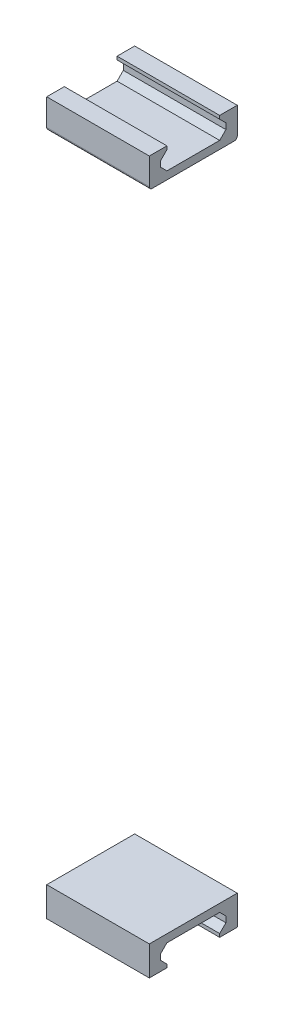
from build123d import *

# Parameters (mm, degrees)
BOSS_EXTRUDE1_DEPTH = 35
FILLET1_R           = 1


with BuildPart() as part:
    # Sketch1 → Boss-Extrude1 (new body)
    with BuildSketch(Plane.YZ):
        Polygon((60.116092999, 26.392150669), (61.250815122, 26.392150669), (61.250815122, 32.392150669), (51.18048308, 32.392150669), (51.18048308, 2.389198142), (61.250815122, 2.389198142), (61.250815122, 8.389198142), (60.116092999, 8.389198142), (57.992886952, 6.265992095), (55.985387253, 6.265992095), (53.862181206, 8.389198142), (53.862181206, 26.392150669), (55.985387253, 28.515356716), (57.992886952, 28.515356716), align=None)
    extrude(amount=BOSS_EXTRUDE1_DEPTH)


with BuildPart() as body_2:
    # Mirror4: mirrored copy
    add(part.part.mirror(Plane.ZX.offset(-60.177818794)))


with BuildPart() as part_1:
    add(part.part)

    # Fillet1
    fillet1_edges = [part_1.edges().sort_by_distance(p)[0] for p in [
        (17.5, 51.18048308, 2.389198142),
        (17.5, 51.18048308, 32.392150669),
    ]]
    fillet(fillet1_edges, radius=FILLET1_R)


solid = Compound([body_2.part, part_1.part])
